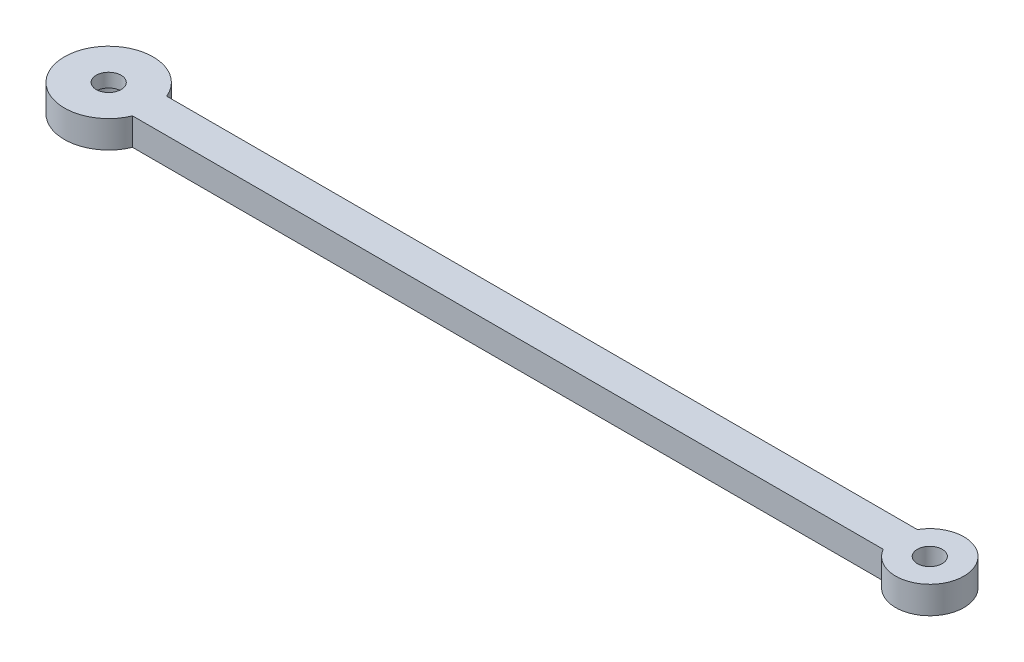
from build123d import *

# Parameters (mm, degrees)
BOSS_EXTRUDE1_DEPTH = 4
SKETCH3_R           = 3.5
CUT_EXTRUDE2_DEPTH  = 2
SKETCH2_R           = 1.825
CUT_EXTRUDE1_DEPTH  = 68.930111144


with BuildPart() as part:
    # Sketch1 → Boss-Extrude1 (new body)
    with BuildSketch(Plane(origin=(0, 0, 0), x_dir=(1, 0, 0), z_dir=(0, 1, 0))):
        with BuildLine():
            Line((-55, 2.5), (55, 2.5))
            ThreePointArc((55, 2.5), (64.330127019, 0), (55, -2.5))
            Line((55, -2.5), (-55, -2.5))
            ThreePointArc((-55, -2.5), (-67.5, 0), (-55, 2.5))
        make_face()
    extrude(amount=BOSS_EXTRUDE1_DEPTH)

    # Sketch3 → Cut-Extrude2 (cut)
    with BuildSketch(Plane.XZ):
        with Locations((-61, 0)):
            Circle(SKETCH3_R)
    extrude(amount=-CUT_EXTRUDE2_DEPTH, mode=Mode.SUBTRACT)

    # Sketch2 → Cut-Extrude1 (cut, through all)
    with BuildSketch(Plane(origin=(0, 4, 0), x_dir=(1, 0, 0), z_dir=(0, 1, 0))):
        with Locations((-61, 0)):
            Circle(SKETCH2_R)
        with Locations((59.330127019, 0)):
            Circle(SKETCH2_R)
    extrude(amount=-CUT_EXTRUDE1_DEPTH, mode=Mode.SUBTRACT)


solid = part.part
